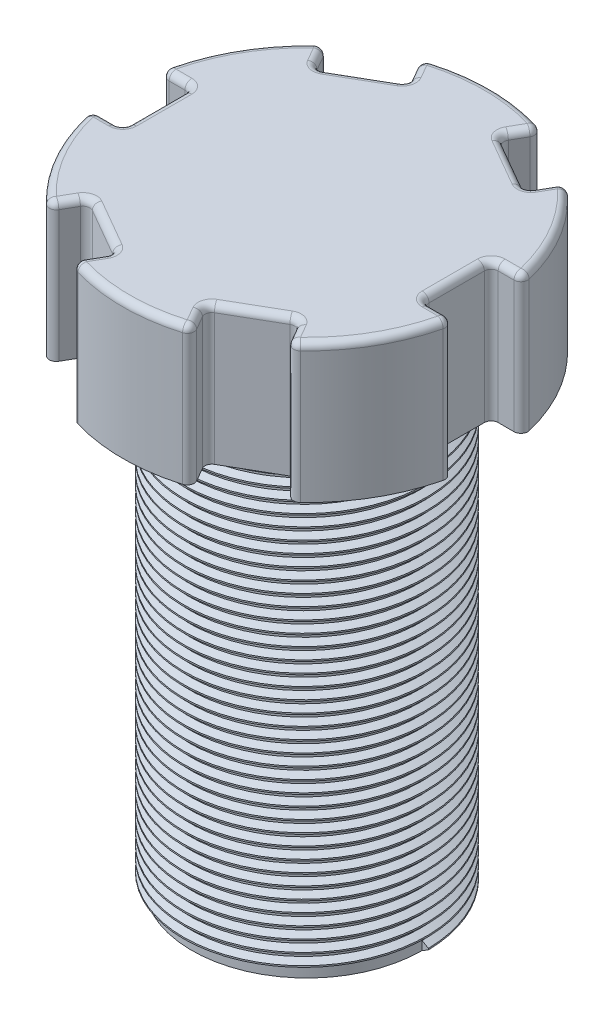
from build123d import *

# Parameters (mm, degrees)
SKETCH1_R                = 4
BOSS_EXTRUDE1_DEPTH      = 3
SKETCH2_R                = 2.5
BOSS_EXTRUDE2_DEPTH      = 10
THREAD1_PITCH            = 0.25
SKETCH8_W                = 1.5
SKETCH8_H                = 1.5
CUT_EXTRUDE1_DEPTH       = 3
FILLET1_R                = 0.15
FILLET2_R                = 0.15
FILLET3_R                = 0.15
FILLET4_R                = 0.15
CIRPATTERN1_COUNT        = 6
FILLET1_OF_CIRPATTERN1_R = 0.15
FILLET2_OF_CIRPATTERN1_R = 0.15
FILLET3_OF_CIRPATTERN1_R = 0.15
FILLET4_OF_CIRPATTERN1_R = 0.15
FILLET5_R                = 0.15


with BuildPart() as part:
    # Sketch1 → Boss-Extrude1 (new body)
    with BuildSketch(Plane(origin=(0, 0, 0), x_dir=(1, 0, 0), z_dir=(0, 1, 0))):
        with Locations(Location((0, 0, 0), (0, 0, 270))):
            Circle(SKETCH1_R)
    extrude(amount=BOSS_EXTRUDE1_DEPTH)

    # Sketch2 → Boss-Extrude2 (add)
    with BuildSketch(Plane.XZ):
        with Locations(Location((0, 0, 0), (0, 0, 270))):
            Circle(SKETCH2_R)
    extrude(amount=BOSS_EXTRUDE2_DEPTH)

    # Thread1: arcs per turn and ends read off the stored shape
    # Thread1: the profile of Thread Profile1 profile screwed along a right-hand helix through 40 turns, 6 arcs to a turn; built about Z, then put on its axis
    thread1_z = Axis((0, 0, 0), (0, 0, 1))
    thread1_corners = [(2.4997, 0, -0.000173205), (2.635316469, 0, 0.078125), (2.635316469, 0, 0.109375), (2.4997, 0, 0.187673204)]
    with BuildLine(mode=Mode.PRIVATE) as thread1_profile:
        Line(thread1_corners[0], thread1_corners[1])
        Line(thread1_corners[1], thread1_corners[2])
        Line(thread1_corners[2], thread1_corners[3])
        Line(thread1_corners[3], thread1_corners[0])
    thread1_cap = Face(thread1_profile.wire())
    thread1_turn_angles = [0, 30, 60, 90, 120, 150, 180, 210, 240, 270, 300, 330, 360]
    thread1_turn_weights = [1, 0.8660254037844387, 1, 0.8660254037844387, 1, 0.8660254037844387, 1, 0.8660254037844387, 1, 0.8660254037844387, 1, 0.8660254037844387, 1]
    thread1_turn_rails = [Edge.make_bspline([Vector(p[0], p[1], 0).rotate(thread1_z, thread1_turn_angles[k]) / thread1_turn_weights[k] + Vector(0, 0, p[2] + THREAD1_PITCH * thread1_turn_angles[k] / 360) for k in range(13)], [0, 0, 0, 1, 1, 2, 2, 3, 3, 4, 4, 5, 5, 6, 6, 6], 2, thread1_turn_weights) for p in thread1_corners]
    thread1_turn_sides = [Face.make_surface_from_curves(thread1_turn_rails[p[0]], thread1_turn_rails[p[1]]) for p in [(0, 1), (1, 2), (2, 3), (3, 0)]]
    thread1 = Plane(origin=(0, -10, 0), x_dir=(1, 0, 0), z_dir=(0, 1, 0)) * Solid(Shell([*[p.moved(Location((0, 0, THREAD1_PITCH * i))) for i in range(40) for p in thread1_turn_sides], thread1_cap, thread1_cap.rotate(thread1_z, 14400).moved(Location((0, 0, THREAD1_PITCH * 14400 / 360)))]))
    add(thread1)

    # Sketch8 → Cut-Extrude1 (cut)
    with BuildSketch(Plane(origin=(0, 3, 0), x_dir=(1, 0, 0), z_dir=(0, 1, 0))):
        with Locations((4, 0)):
            Rectangle(SKETCH8_W, SKETCH8_H)
    cut_extrude1 = extrude(amount=-CUT_EXTRUDE1_DEPTH, mode=Mode.SUBTRACT)

    # Fillet1
    fillet1_edges = [part.edges().sort_by_distance(p)[0] for p in [
        (3.929058411, 1.5, -0.75),
    ]]
    fillet(fillet1_edges, radius=FILLET1_R)

    # Fillet2
    fillet2_edges = [part.edges().sort_by_distance(p)[0] for p in [
        (3.25, 1.5, 0.75),
    ]]
    fillet(fillet2_edges, radius=FILLET2_R)

    # Fillet3
    fillet3_edges = [part.edges().sort_by_distance(p)[0] for p in [
        (3.929058411, 1.5, 0.75),
    ]]
    fillet(fillet3_edges, radius=FILLET3_R)

    # Fillet4
    fillet4_edges = [part.edges().sort_by_distance(p)[0] for p in [
        (3.25, 1.5, -0.75),
    ]]
    fillet(fillet4_edges, radius=FILLET4_R)

    # CirPattern1: Cut-Extrude1 ×6 about axis
    cirpattern1_axis = Axis((0, 0, 0), (0, 1, 0))
    for i in range(1, CIRPATTERN1_COUNT):
        add(cut_extrude1.rotate(cirpattern1_axis, i * 360 / CIRPATTERN1_COUNT), mode=Mode.SUBTRACT)

    # Fillet1 of CirPattern1
    fillet1_of_cirpattern1_edges = [part.edges().sort_by_distance(p)[0] for p in [
        (1.315010153, 1.5, -3.777664397),
        (-2.614048259, 1.5, -3.027664397),
        (-3.929058411, 1.5, 0.75),
        (-1.315010153, 1.5, 3.777664397),
        (2.614048259, 1.5, 3.027664397),
    ]]
    fillet(fillet1_of_cirpattern1_edges, radius=FILLET1_OF_CIRPATTERN1_R)

    # Fillet2 of CirPattern1
    fillet2_of_cirpattern1_edges = [part.edges().sort_by_distance(p)[0] for p in [
        (2.274519053, 1.5, -2.439582562),
        (-0.975480947, 1.5, -3.189582562),
        (-3.25, 1.5, -0.75),
        (-2.274519053, 1.5, 2.439582562),
        (0.975480947, 1.5, 3.189582562),
    ]]
    fillet(fillet2_of_cirpattern1_edges, radius=FILLET2_OF_CIRPATTERN1_R)

    # Fillet3 of CirPattern1
    fillet3_of_cirpattern1_edges = [part.edges().sort_by_distance(p)[0] for p in [
        (2.614048259, 1.5, -3.027664397),
        (-1.315010153, 1.5, -3.777664397),
        (-3.929058411, 1.5, -0.75),
        (-2.614048259, 1.5, 3.027664397),
        (1.315010153, 1.5, 3.777664397),
    ]]
    fillet(fillet3_of_cirpattern1_edges, radius=FILLET3_OF_CIRPATTERN1_R)

    # Fillet4 of CirPattern1
    fillet4_of_cirpattern1_edges = [part.edges().sort_by_distance(p)[0] for p in [
        (0.975480947, 1.5, -3.189582562),
        (-2.274519053, 1.5, -2.439582562),
        (-3.25, 1.5, 0.75),
        (-0.975480947, 1.5, 3.189582562),
        (2.274519053, 1.5, 2.439582562),
    ]]
    fillet(fillet4_of_cirpattern1_edges, radius=FILLET4_OF_CIRPATTERN1_R)

    # Fillet5
    fillet5_edges = [part.edges().sort_by_distance(p)[0] for p in [
        (0, 3, -4),
        (1.136312796, 3, -3.468151497),
        (1.231553095, 3, -3.747423223),
        (-3.464101615, 3, -2),
        (-2.435350902, 3, -2.718151497),
        (-2.629587163, 3, -2.940267878),
        (-3.464101615, 3, 2),
        (-3.571663698, 3, 0.75),
        (-3.861140257, 3, 0.807155345),
        (0, 3, 4),
        (-1.136312796, 3, 3.468151497),
        (-1.231553095, 3, 3.747423223),
        (3.464101615, 3, 2),
        (2.435350902, 3, 2.718151497),
        (2.629587163, 3, 2.940267878),
        (2.435350902, 3, -2.718151497),
        (2.258438099, 3, -2.499597499),
        (-1.136312796, 3, -3.468151497),
        (-1.035495884, 3, -3.205663516),
        (-3.571663698, 3, -0.75),
        (-3.293933983, 3, -0.706066017),
        (-2.435350902, 3, 2.718151497),
        (-2.258438099, 3, 2.499597499),
        (1.136312796, 3, 3.468151497),
        (1.035495884, 3, 3.205663516),
        (2.629587163, 3, -2.940267878),
        (-1.231553095, 3, -3.747423223),
        (-3.861140257, 3, -0.807155345),
        (-2.629587163, 3, 2.940267878),
        (1.231553095, 3, 3.747423223),
        (1.625, 3, -2.814582562),
        (1.035495884, 3, -3.205663516),
        (-1.625, 3, -2.814582562),
        (-2.258438099, 3, -2.499597499),
        (-3.25, 3, 0),
        (-3.293933983, 3, 0.706066017),
        (-1.625, 3, 2.814582562),
        (-1.035495884, 3, 3.205663516),
        (1.625, 3, 2.814582562),
        (2.258438099, 3, 2.499597499),
        (3.464101615, 3, -2),
        (3.571663698, 3, -0.75),
        (3.861140257, 3, -0.807155345),
        (3.571663698, 3, 0.75),
        (3.293933983, 3, 0.706066017),
        (3.861140257, 3, 0.807155345),
        (3.25, 3, 0),
        (3.293933983, 3, -0.706066017),
    ]]
    fillet(fillet5_edges, radius=FILLET5_R)


solid = part.part
